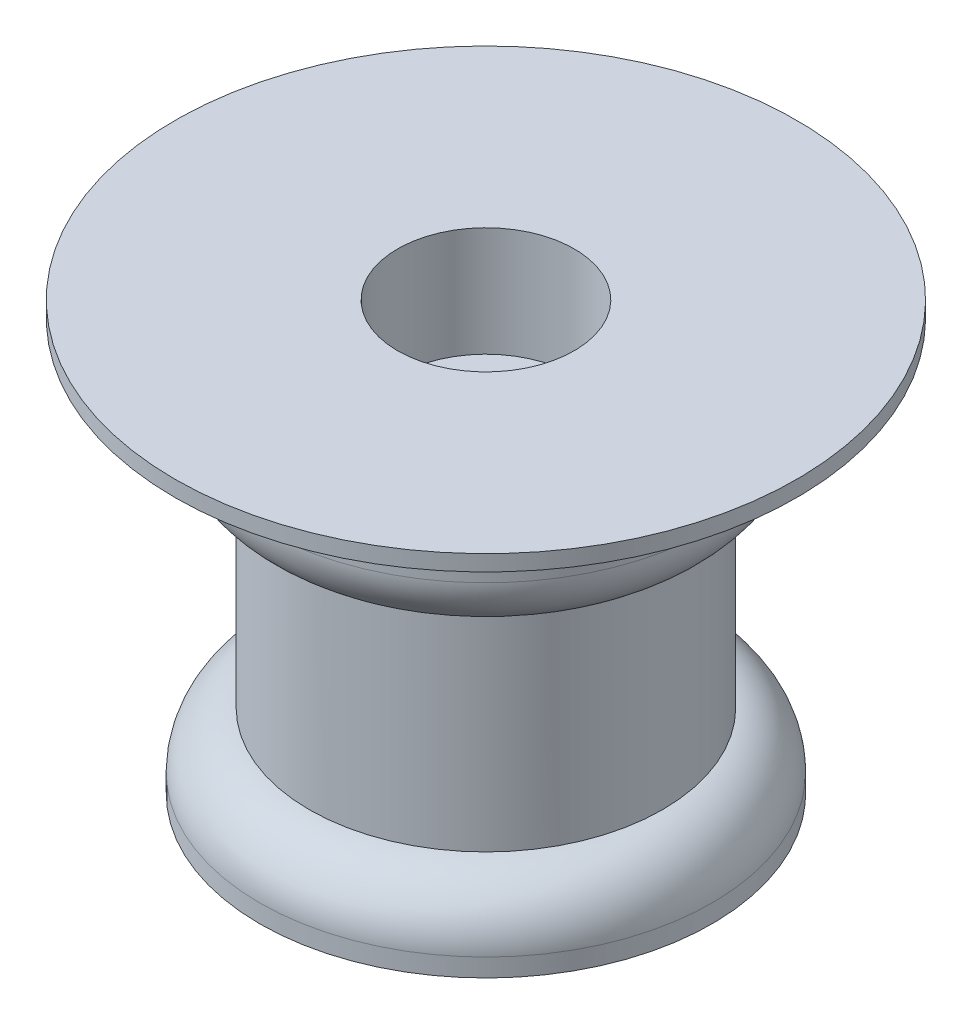
from build123d import *

# Parameters (mm, degrees)
SKETCH_1_R          = 32
SKETCH_1_R_2        = 2.3
EXTRUDE_1_DEPTH     = 51
SKETCH_2_R          = 13.15
CUT_EXTRUDE_1_DEPTH = 40
CUT_EXTRUDE_START   = -10.5
SKETCH_16_R         = 36.699938781
SKETCH_16_R_2       = 25
CUT_EXTRUDE_5_DEPTH = 30
FILLET_4_R          = 8
SKETCH_17_R         = 12.5
CUT_EXTRUDE_6_DEPTH = 6
SKETCH_18_R         = 32
SKETCH_18_R_2       = 12.5
EXTRUDE_2_DEPTH     = 7.25
SKETCH_19_R         = 44
SKETCH_19_R_2       = 12.5
EXTRUDE_3_DEPTH     = 2.25
FILLET_5_R          = 8


with BuildPart() as part:
    # Эскиз1 → Бобышка-Вытянуть1 (new body)
    with BuildSketch(Plane(origin=(0, 0, 0), x_dir=(1, 0, 0), z_dir=(0, 1, 0))):
        with Locations(Location((0, 0, 0), (0, 0, 270))):
            Circle(SKETCH_1_R)
        with Locations(Location((0, 0, 0), (0, 0, 270))):
            Circle(SKETCH_1_R_2, mode=Mode.SUBTRACT)
    extrude(amount=EXTRUDE_1_DEPTH)

    # Эскиз2 → Вырез-Вытянуть1 (cut)
    with BuildSketch(Plane.XZ):
        with Locations(Location((0, 0, 0), (0, 0, 270))):
            Circle(SKETCH_2_R)
    extrude(amount=-CUT_EXTRUDE_1_DEPTH, mode=Mode.SUBTRACT)

    # Эскиз16 → Вырез-Вытянуть5 (cut)
    with BuildSketch(Plane.XZ.offset(CUT_EXTRUDE_START)):
        Circle(SKETCH_16_R)
        with Locations(Location((0, 0, 0), (0, 0, 270))):
            Circle(SKETCH_16_R_2, mode=Mode.SUBTRACT)
    extrude(amount=-CUT_EXTRUDE_5_DEPTH, mode=Mode.SUBTRACT)

    # Скругление4
    # the kernel refuses this fillet: 8 mm, written as the material it takes off along each edge
    with BuildSketch(Plane(origin=(0, 10.5, 0), x_dir=(0, 0, 1), z_dir=(1, 0, 0))) as fillet_4_piece_1:
        with BuildLine():
            CenterArc((24, 7.937253933), FILLET_4_R, 277.180755781, 82.819244219)
            Line((25, 0), (25.02, -0.158745079))
            ThreePointArc((25.02, -0.158745079), (28.5, -0.16), (32, -0.16))
            Line((32, -0.16), (32.16, 0))
            Line((32.16, 0), (32.16, 7.937253933))
            Line((32.16, 7.937253933), (32, 7.937253933))
        make_face()
    revolve(axis=Axis((0, 10.5, 0), (0, -1, 0)), mode=Mode.SUBTRACT)
    with BuildSketch(Plane(origin=(0, 40.5, 0), x_dir=(0, 0, 1), z_dir=(1, 0, 0))) as fillet_4_piece_2:
        with BuildLine():
            CenterArc((24, -7.937253933), FILLET_4_R, 0, 82.819244219)
            Line((32, -7.937253933), (32.16, -7.937253933))
            Line((32.16, -7.937253933), (32.16, 0))
            Line((32.16, 0), (32, 0.16))
            ThreePointArc((32, 0.16), (28.5, 0.16), (25.02, 0.158745079))
            Line((25.02, 0.158745079), (25, 0))
        make_face()
    revolve(axis=Axis((0, 40.5, 0), (0, -1, 0)), mode=Mode.SUBTRACT)

    # Эскиз17 → Вырез-Вытянуть6 (cut)
    with BuildSketch(Plane(origin=(0, 51, 0), x_dir=(1, 0, 0), z_dir=(0, 1, 0))):
        with Locations(Location((0, 0, 0), (0, 0, 270))):
            Circle(SKETCH_17_R)
    extrude(amount=-CUT_EXTRUDE_6_DEPTH, mode=Mode.SUBTRACT)

    # Эскиз18 → Бобышка-Вытянуть2 (add)
    with BuildSketch(Plane(origin=(0, 51, 0), x_dir=(1, 0, 0), z_dir=(0, 1, 0))):
        with Locations(Location((0, 0, 0), (0, 0, 90))):
            Circle(SKETCH_18_R)
        with Locations(Location((0, 0, 0), (0, 0, 270))):
            Circle(SKETCH_18_R_2, mode=Mode.SUBTRACT)
    extrude(amount=EXTRUDE_2_DEPTH)

    # Эскиз19 → Бобышка-Вытянуть3 (add)
    with BuildSketch(Plane(origin=(0, 58.25, 0), x_dir=(1, 0, 0), z_dir=(0, 1, 0))):
        with Locations(Location((0, 0, 0), (0, 0, 270))):
            Circle(SKETCH_19_R)
        with Locations(Location((0, 0, 0), (0, 0, 270))):
            Circle(SKETCH_19_R_2, mode=Mode.SUBTRACT)
    extrude(amount=EXTRUDE_3_DEPTH)

    # Скругление5
    fillet_5_edges = [part.edges().sort_by_distance(p)[0] for p in [
        (0, 58.25, 32),
    ]]
    fillet(fillet_5_edges, radius=FILLET_5_R)


solid = part.part
